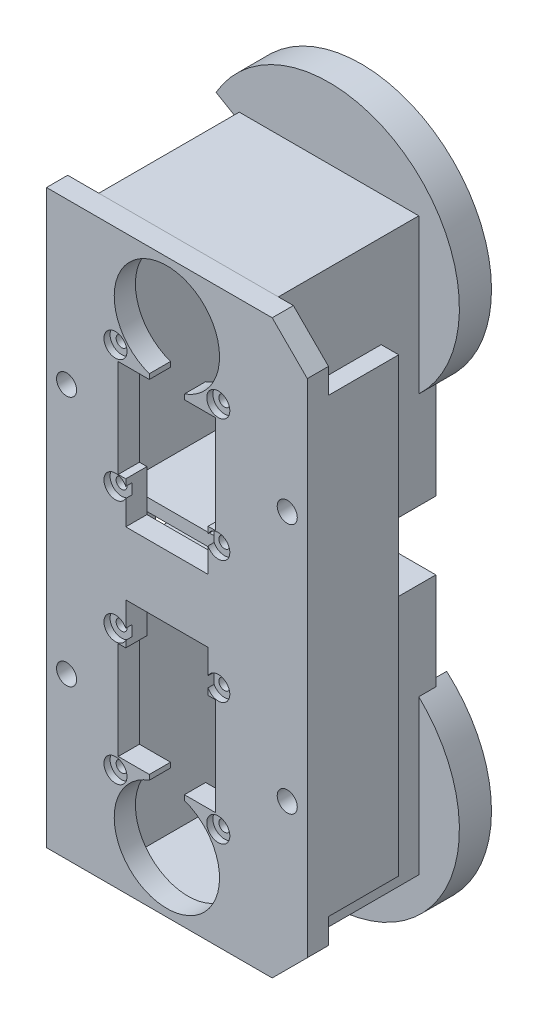
from build123d import *

# Parameters (mm, degrees)
BOSS_1_DEPTH    = 4.225
S_BOX2_W        = 3.5
S_BOX2_H        = 90
BOSS_2_DEPTH    = 14.5
S_BOX3_W        = 3.5
S_BOX3_H        = 90
BOSS_3_DEPTH    = 14.5
S_BOX4_W        = 35.8
S_BOX4_H        = 2.5
BOSS_4_DEPTH    = 35.725
S_BOX5_W        = 35.8
S_BOX5_H        = 1.2
BOSS_5_DEPTH    = 35.725
S_BOX6_W        = 5
S_BOX6_H        = 50.1
BOSS_6_DEPTH    = 35.725
S_BOX7_W        = 5
S_BOX7_H        = 50.1
BOSS_7_DEPTH    = 35.725
S_BOX8_W        = 35.8
S_BOX8_H        = 50.1
BOSS_8_DEPTH    = 4.225
S_CYL9_R        = 19
BOSS_9_DEPTH    = 2.6
BOSS_10_DEPTH   = 6.4
S_BOX11_W       = 35.8
S_BOX11_H       = 1.2
BOSS_11_DEPTH   = 35.725
S_BOX12_W       = 35.8
S_BOX12_H       = 2.5
BOSS_12_DEPTH   = 35.725
S_BOX13_W       = 5
S_BOX13_H       = 50.1
BOSS_13_DEPTH   = 35.725
S_BOX14_W       = 5
S_BOX14_H       = 50.1
BOSS_14_DEPTH   = 35.725
S_BOX15_W       = 35.8
S_BOX15_H       = 50.1
BOSS_15_DEPTH   = 4.225
S_CYL16_R       = 19
BOSS_16_DEPTH   = 2.6
BOSS_17_DEPTH   = 6.4
S_HOLE18_R      = 10.5
HOLE_18_DEPTH   = 4.425
S_CUT19_W       = 19.4
S_CUT19_H       = 19.5
POCKET_19_DEPTH = 4.375
S_CUT20_W       = 16.4
S_CUT20_H       = 8.3
POCKET_20_DEPTH = 4.375
S_CUT21_W       = 7
S_CUT21_H       = 11
POCKET_21_DEPTH = 4.375
S_HOLE22_R      = 1.1
HOLE_22_DEPTH   = 4.425
S_HOLE23_R      = 2.3
HOLE_23_DEPTH   = 1.325
S_HOLE24_R      = 1.1
HOLE_24_DEPTH   = 4.425
S_HOLE25_R      = 2.3
HOLE_25_DEPTH   = 1.325
S_HOLE26_R      = 1.1
HOLE_26_DEPTH   = 4.425
S_HOLE27_R      = 2.3
HOLE_27_DEPTH   = 1.325
S_HOLE28_R      = 1.1
HOLE_28_DEPTH   = 4.425
S_HOLE29_R      = 2.3
HOLE_29_DEPTH   = 1.325
S_CUT30_W       = 25.8
S_CUT30_H       = 46.4
POCKET_30_DEPTH = 6.65
S_HOLE31_R      = 11.5
HOLE_31_DEPTH   = 3.2
S_HOLE32_R      = 0.9
HOLE_32_DEPTH   = 5.7
S_HOLE33_R      = 0.9
HOLE_33_DEPTH   = 5.7
S_HOLE34_R      = 0.9
HOLE_34_DEPTH   = 5.7
S_HOLE35_R      = 0.9
HOLE_35_DEPTH   = 5.7
S_HOLE36_R      = 0.9
HOLE_36_DEPTH   = 5.7
S_HOLE37_R      = 10.5
HOLE_37_DEPTH   = 4.425
S_CUT38_W       = 19.4
S_CUT38_H       = 19.5
POCKET_38_DEPTH = 4.375
S_CUT39_W       = 16.4
S_CUT39_H       = 8.3
POCKET_39_DEPTH = 4.375
S_CUT40_W       = 7
S_CUT40_H       = 11
POCKET_40_DEPTH = 4.375
S_HOLE41_R      = 1.1
HOLE_41_DEPTH   = 4.425
S_HOLE42_R      = 2.3
HOLE_42_DEPTH   = 1.325
S_HOLE43_R      = 1.1
HOLE_43_DEPTH   = 4.425
S_HOLE44_R      = 2.3
HOLE_44_DEPTH   = 1.325
S_HOLE45_R      = 1.1
HOLE_45_DEPTH   = 4.425
S_HOLE46_R      = 2.3
HOLE_46_DEPTH   = 1.325
S_HOLE47_R      = 1.1
HOLE_47_DEPTH   = 4.425
S_HOLE48_R      = 2.3
HOLE_48_DEPTH   = 1.325
S_CUT49_W       = 25.8
S_CUT49_H       = 46.4
POCKET_49_DEPTH = 6.65
S_HOLE50_R      = 11.5
HOLE_50_DEPTH   = 3.2
S_HOLE51_R      = 0.9
HOLE_51_DEPTH   = 5.7
S_HOLE52_R      = 0.9
HOLE_52_DEPTH   = 5.7
S_HOLE53_R      = 0.9
HOLE_53_DEPTH   = 5.7
S_HOLE54_R      = 0.9
HOLE_54_DEPTH   = 5.7
S_HOLE55_R      = 0.9
HOLE_55_DEPTH   = 5.7
S_HOLE56_R      = 2
HOLE_56_DEPTH   = 4.425
S_HOLE57_R      = 1.7
HOLE_57_DEPTH   = 4.1
S_HOLE58_R      = 2
HOLE_58_DEPTH   = 4.425
S_HOLE59_R      = 1.7
HOLE_59_DEPTH   = 4.1
S_HOLE60_R      = 2
HOLE_60_DEPTH   = 4.425
S_HOLE61_R      = 1.7
HOLE_61_DEPTH   = 4.1
S_HOLE62_R      = 2
HOLE_62_DEPTH   = 4.425
S_HOLE63_R      = 1.7
HOLE_63_DEPTH   = 4.1


with BuildPart() as part:
    # S_prism1 → Boss_1 (new body)
    with BuildSketch(Plane.XY.offset(64.7)):
        Polygon((28, -50), (28, 50), (21, 57), (-24, 57), (-24, -57), (21, -57), align=None)
    extrude(amount=BOSS_1_DEPTH)

    # S_box2 → Boss_2 (add)
    with BuildSketch(Plane.XY.offset(50.7)):
        with Locations((26.25, 0)):
            Rectangle(S_BOX2_W, S_BOX2_H)
    extrude(amount=BOSS_2_DEPTH)

    # S_box3 → Boss_3 (add)
    with BuildSketch(Plane.XY.offset(50.7)):
        with Locations((-22.25, 0)):
            Rectangle(S_BOX3_W, S_BOX3_H)
    extrude(amount=BOSS_3_DEPTH)

    # S_box4 → Boss_4 (add)
    with BuildSketch(Plane.XY.offset(33.2)):
        with Locations((0, 8.05)):
            Rectangle(S_BOX4_W, S_BOX4_H)
    extrude(amount=BOSS_4_DEPTH)

    # S_box5 → Boss_5 (add)
    with BuildSketch(Plane.XY.offset(33.2)):
        with Locations((0, 56.3)):
            Rectangle(S_BOX5_W, S_BOX5_H)
    extrude(amount=BOSS_5_DEPTH)

    # S_box6 → Boss_6 (add)
    with BuildSketch(Plane.XY.offset(33.2)):
        with Locations((-15.4, 31.85)):
            Rectangle(S_BOX6_W, S_BOX6_H)
    extrude(amount=BOSS_6_DEPTH)

    # S_box7 → Boss_7 (add)
    with BuildSketch(Plane.XY.offset(33.2)):
        with Locations((15.4, 31.85)):
            Rectangle(S_BOX7_W, S_BOX7_H)
    extrude(amount=BOSS_7_DEPTH)

    # S_box8 → Boss_8 (add)
    with BuildSketch(Plane.XY.offset(64.7)):
        with Locations((0, 31.85)):
            Rectangle(S_BOX8_W, S_BOX8_H)
    extrude(amount=BOSS_8_DEPTH)



with BuildPart() as body_2:
    # S_cyl9 → Boss_9 (new body)
    with BuildSketch(Plane.XY.offset(30.1)):
        with Locations((0, 45)):
            Circle(S_CYL9_R)
    extrude(amount=BOSS_9_DEPTH)


with BuildPart() as part_1:
    add(part.part)

    add(body_2.part)  # Boss_10 merges body 2
    # S_prism10 → Boss_10 (add)
    with BuildSketch(Plane.XY.offset(30.2)):
        with BuildLine():
            Line((-22.516660498, 58), (-9.526279442, 50.5))
            ThreePointArc((-9.526279442, 50.5), (6.996860423, 53.487870417), (7.216649319, 36.698194618))
            Line((7.216649319, 36.698194618), (17.057534754, 25.377550914))
            ThreePointArc((17.057534754, 25.377550914), (16.538033727, 65.062239168), (-22.516660498, 58))
        make_face()
    extrude(amount=BOSS_10_DEPTH)

    # S_box11 → Boss_11 (add)
    with BuildSketch(Plane.XY.offset(33.2)):
        with Locations((0, -56.3)):
            Rectangle(S_BOX11_W, S_BOX11_H)
    extrude(amount=BOSS_11_DEPTH)

    # S_box12 → Boss_12 (add)
    with BuildSketch(Plane.XY.offset(33.2)):
        with Locations((0, -8.05)):
            Rectangle(S_BOX12_W, S_BOX12_H)
    extrude(amount=BOSS_12_DEPTH)

    # S_box13 → Boss_13 (add)
    with BuildSketch(Plane.XY.offset(33.2)):
        with Locations((-15.4, -31.85)):
            Rectangle(S_BOX13_W, S_BOX13_H)
    extrude(amount=BOSS_13_DEPTH)

    # S_box14 → Boss_14 (add)
    with BuildSketch(Plane.XY.offset(33.2)):
        with Locations((15.4, -31.85)):
            Rectangle(S_BOX14_W, S_BOX14_H)
    extrude(amount=BOSS_14_DEPTH)

    # S_box15 → Boss_15 (add)
    with BuildSketch(Plane.XY.offset(64.7)):
        with Locations((0, -31.85)):
            Rectangle(S_BOX15_W, S_BOX15_H)
    extrude(amount=BOSS_15_DEPTH)



with BuildPart() as body_2_2:
    # S_cyl16 → Boss_16 (new body)
    with BuildSketch(Plane.XY.offset(30.1)):
        with Locations((0, -45)):
            Circle(S_CYL16_R)
    extrude(amount=BOSS_16_DEPTH)


with BuildPart() as part_2:
    add(part_1.part)

    add(body_2_2.part)  # Boss_17 merges body 2 2
    # S_prism17 → Boss_17 (add)
    with BuildSketch(Plane.XY.offset(30.2)):
        with BuildLine():
            Line((17.057534754, -25.377550914), (7.216649319, -36.698194618))
            ThreePointArc((7.216649319, -36.698194618), (6.996860423, -53.487870417), (-9.526279442, -50.5))
            Line((-9.526279442, -50.5), (-22.516660498, -58))
            ThreePointArc((-22.516660498, -58), (16.538033727, -65.062239168), (17.057534754, -25.377550914))
        make_face()
    extrude(amount=BOSS_17_DEPTH)

    # S_hole18 → Hole_18 (cut)
    with BuildSketch(Plane.XY.offset(64.6)):
        with Locations((0, 45)):
            Circle(S_HOLE18_R)
    extrude(amount=HOLE_18_DEPTH, mode=Mode.SUBTRACT)

    # S_cut19 → Pocket_19 (cut)
    with BuildSketch(Plane.XY.offset(64.65)):
        with Locations((0, 24.35)):
            Rectangle(S_CUT19_W, S_CUT19_H)
    extrude(amount=POCKET_19_DEPTH, mode=Mode.SUBTRACT)

    # S_cut20 → Pocket_20 (cut)
    with BuildSketch(Plane.XY.offset(64.65)):
        with Locations((0, 10.45)):
            Rectangle(S_CUT20_W, S_CUT20_H)
    extrude(amount=POCKET_20_DEPTH, mode=Mode.SUBTRACT)

    # S_cut21 → Pocket_21 (cut)
    with BuildSketch(Plane.XY.offset(64.65)):
        with Locations((0, 39.5)):
            Rectangle(S_CUT21_W, S_CUT21_H)
    extrude(amount=POCKET_21_DEPTH, mode=Mode.SUBTRACT)

    # S_hole22 → Hole_22 (cut)
    with BuildSketch(Plane.XY.offset(64.6)):
        with Locations((-10.25, 36.7)):
            Circle(S_HOLE22_R)
    extrude(amount=HOLE_22_DEPTH, mode=Mode.SUBTRACT)

    # S_hole23 → Hole_23 (cut)
    with BuildSketch(Plane.XY.offset(67.7)):
        with Locations((-10.25, 36.7)):
            Circle(S_HOLE23_R)
    extrude(amount=HOLE_23_DEPTH, mode=Mode.SUBTRACT)

    # S_hole24 → Hole_24 (cut)
    with BuildSketch(Plane.XY.offset(64.6)):
        with Locations((10.25, 36.7)):
            Circle(S_HOLE24_R)
    extrude(amount=HOLE_24_DEPTH, mode=Mode.SUBTRACT)

    # S_hole25 → Hole_25 (cut)
    with BuildSketch(Plane.XY.offset(67.7)):
        with Locations((10.25, 36.7)):
            Circle(S_HOLE25_R)
    extrude(amount=HOLE_25_DEPTH, mode=Mode.SUBTRACT)

    # S_hole26 → Hole_26 (cut)
    with BuildSketch(Plane.XY.offset(64.6)):
        with Locations((-10.25, 12.25)):
            Circle(S_HOLE26_R)
    extrude(amount=HOLE_26_DEPTH, mode=Mode.SUBTRACT)

    # S_hole27 → Hole_27 (cut)
    with BuildSketch(Plane.XY.offset(67.7)):
        with Locations((-10.25, 12.25)):
            Circle(S_HOLE27_R)
    extrude(amount=HOLE_27_DEPTH, mode=Mode.SUBTRACT)

    # S_hole28 → Hole_28 (cut)
    with BuildSketch(Plane.XY.offset(64.6)):
        with Locations((10.25, 12.25)):
            Circle(S_HOLE28_R)
    extrude(amount=HOLE_28_DEPTH, mode=Mode.SUBTRACT)

    # S_hole29 → Hole_29 (cut)
    with BuildSketch(Plane.XY.offset(67.7)):
        with Locations((10.25, 12.25)):
            Circle(S_HOLE29_R)
    extrude(amount=HOLE_29_DEPTH, mode=Mode.SUBTRACT)

    # S_cut30 → Pocket_30 (cut)
    with BuildSketch(Plane.XY.offset(30.05)):
        with Locations((0, 32.5)):
            Rectangle(S_CUT30_W, S_CUT30_H)
    extrude(amount=POCKET_30_DEPTH, mode=Mode.SUBTRACT)

    # S_hole31 → Hole_31 (cut)
    with BuildSketch(Plane.XY.offset(30.1)):
        with Locations((0, 45)):
            Circle(S_HOLE31_R)
    extrude(amount=HOLE_31_DEPTH, mode=Mode.SUBTRACT)

    # S_hole32 → Hole_32 (cut)
    with BuildSketch(Plane.XY.offset(30.1)):
        with Locations((18.021344974, 32.3813184)):
            Circle(S_HOLE32_R)
    extrude(amount=HOLE_32_DEPTH, mode=Mode.SUBTRACT)

    # S_hole33 → Hole_33 (cut)
    with BuildSketch(Plane.XY.offset(30.1)):
        with Locations((21.916283358, 46.91742634)):
            Circle(S_HOLE33_R)
    extrude(amount=HOLE_33_DEPTH, mode=Mode.SUBTRACT)

    # S_hole34 → Hole_34 (cut)
    with BuildSketch(Plane.XY.offset(30.1)):
        with Locations((15.556349186, 60.556349186)):
            Circle(S_HOLE34_R)
    extrude(amount=HOLE_34_DEPTH, mode=Mode.SUBTRACT)

    # S_hole35 → Hole_35 (cut)
    with BuildSketch(Plane.XY.offset(30.1)):
        with Locations((1.91742634, 66.916283358)):
            Circle(S_HOLE35_R)
    extrude(amount=HOLE_35_DEPTH, mode=Mode.SUBTRACT)

    # S_hole36 → Hole_36 (cut)
    with BuildSketch(Plane.XY.offset(30.1)):
        with Locations((-9.297601758, 64.938771315)):
            Circle(S_HOLE36_R)
    extrude(amount=HOLE_36_DEPTH, mode=Mode.SUBTRACT)

    # S_hole37 → Hole_37 (cut)
    with BuildSketch(Plane.XY.offset(64.6)):
        with Locations((0, -45)):
            Circle(S_HOLE37_R)
    extrude(amount=HOLE_37_DEPTH, mode=Mode.SUBTRACT)

    # S_cut38 → Pocket_38 (cut)
    with BuildSketch(Plane.XY.offset(64.65)):
        with Locations((0, -24.35)):
            Rectangle(S_CUT38_W, S_CUT38_H)
    extrude(amount=POCKET_38_DEPTH, mode=Mode.SUBTRACT)

    # S_cut39 → Pocket_39 (cut)
    with BuildSketch(Plane.XY.offset(64.65)):
        with Locations((0, -10.45)):
            Rectangle(S_CUT39_W, S_CUT39_H)
    extrude(amount=POCKET_39_DEPTH, mode=Mode.SUBTRACT)

    # S_cut40 → Pocket_40 (cut)
    with BuildSketch(Plane.XY.offset(64.65)):
        with Locations((0, -39.5)):
            Rectangle(S_CUT40_W, S_CUT40_H)
    extrude(amount=POCKET_40_DEPTH, mode=Mode.SUBTRACT)

    # S_hole41 → Hole_41 (cut)
    with BuildSketch(Plane.XY.offset(64.6)):
        with Locations((-10.25, -36.7)):
            Circle(S_HOLE41_R)
    extrude(amount=HOLE_41_DEPTH, mode=Mode.SUBTRACT)

    # S_hole42 → Hole_42 (cut)
    with BuildSketch(Plane.XY.offset(67.7)):
        with Locations((-10.25, -36.7)):
            Circle(S_HOLE42_R)
    extrude(amount=HOLE_42_DEPTH, mode=Mode.SUBTRACT)

    # S_hole43 → Hole_43 (cut)
    with BuildSketch(Plane.XY.offset(64.6)):
        with Locations((10.25, -36.7)):
            Circle(S_HOLE43_R)
    extrude(amount=HOLE_43_DEPTH, mode=Mode.SUBTRACT)

    # S_hole44 → Hole_44 (cut)
    with BuildSketch(Plane.XY.offset(67.7)):
        with Locations((10.25, -36.7)):
            Circle(S_HOLE44_R)
    extrude(amount=HOLE_44_DEPTH, mode=Mode.SUBTRACT)

    # S_hole45 → Hole_45 (cut)
    with BuildSketch(Plane.XY.offset(64.6)):
        with Locations((-10.25, -12.25)):
            Circle(S_HOLE45_R)
    extrude(amount=HOLE_45_DEPTH, mode=Mode.SUBTRACT)

    # S_hole46 → Hole_46 (cut)
    with BuildSketch(Plane.XY.offset(67.7)):
        with Locations((-10.25, -12.25)):
            Circle(S_HOLE46_R)
    extrude(amount=HOLE_46_DEPTH, mode=Mode.SUBTRACT)

    # S_hole47 → Hole_47 (cut)
    with BuildSketch(Plane.XY.offset(64.6)):
        with Locations((10.25, -12.25)):
            Circle(S_HOLE47_R)
    extrude(amount=HOLE_47_DEPTH, mode=Mode.SUBTRACT)

    # S_hole48 → Hole_48 (cut)
    with BuildSketch(Plane.XY.offset(67.7)):
        with Locations((10.25, -12.25)):
            Circle(S_HOLE48_R)
    extrude(amount=HOLE_48_DEPTH, mode=Mode.SUBTRACT)

    # S_cut49 → Pocket_49 (cut)
    with BuildSketch(Plane.XY.offset(30.05)):
        with Locations((0, -32.5)):
            Rectangle(S_CUT49_W, S_CUT49_H)
    extrude(amount=POCKET_49_DEPTH, mode=Mode.SUBTRACT)

    # S_hole50 → Hole_50 (cut)
    with BuildSketch(Plane.XY.offset(30.1)):
        with Locations((0, -45)):
            Circle(S_HOLE50_R)
    extrude(amount=HOLE_50_DEPTH, mode=Mode.SUBTRACT)

    # S_hole51 → Hole_51 (cut)
    with BuildSketch(Plane.XY.offset(30.1)):
        with Locations((18.021344974, -32.3813184)):
            Circle(S_HOLE51_R)
    extrude(amount=HOLE_51_DEPTH, mode=Mode.SUBTRACT)

    # S_hole52 → Hole_52 (cut)
    with BuildSketch(Plane.XY.offset(30.1)):
        with Locations((21.916283358, -46.91742634)):
            Circle(S_HOLE52_R)
    extrude(amount=HOLE_52_DEPTH, mode=Mode.SUBTRACT)

    # S_hole53 → Hole_53 (cut)
    with BuildSketch(Plane.XY.offset(30.1)):
        with Locations((15.556349186, -60.556349186)):
            Circle(S_HOLE53_R)
    extrude(amount=HOLE_53_DEPTH, mode=Mode.SUBTRACT)

    # S_hole54 → Hole_54 (cut)
    with BuildSketch(Plane.XY.offset(30.1)):
        with Locations((1.91742634, -66.916283358)):
            Circle(S_HOLE54_R)
    extrude(amount=HOLE_54_DEPTH, mode=Mode.SUBTRACT)

    # S_hole55 → Hole_55 (cut)
    with BuildSketch(Plane.XY.offset(30.1)):
        with Locations((-9.297601758, -64.938771315)):
            Circle(S_HOLE55_R)
    extrude(amount=HOLE_55_DEPTH, mode=Mode.SUBTRACT)

    # S_hole56 → Hole_56 (cut)
    with BuildSketch(Plane.XY.offset(64.6)):
        with Locations((-20, -25)):
            Circle(S_HOLE56_R)
    extrude(amount=HOLE_56_DEPTH, mode=Mode.SUBTRACT)

    # S_hole57 → Hole_57 (cut)
    with BuildSketch(Plane.XY.offset(60.7)):
        with Locations((-20, -25)):
            Circle(S_HOLE57_R)
    extrude(amount=HOLE_57_DEPTH, mode=Mode.SUBTRACT)

    # S_hole58 → Hole_58 (cut)
    with BuildSketch(Plane.XY.offset(64.6)):
        with Locations((-20, 25)):
            Circle(S_HOLE58_R)
    extrude(amount=HOLE_58_DEPTH, mode=Mode.SUBTRACT)

    # S_hole59 → Hole_59 (cut)
    with BuildSketch(Plane.XY.offset(60.7)):
        with Locations((-20, 25)):
            Circle(S_HOLE59_R)
    extrude(amount=HOLE_59_DEPTH, mode=Mode.SUBTRACT)

    # S_hole60 → Hole_60 (cut)
    with BuildSketch(Plane.XY.offset(64.6)):
        with Locations((24, -25)):
            Circle(S_HOLE60_R)
    extrude(amount=HOLE_60_DEPTH, mode=Mode.SUBTRACT)

    # S_hole61 → Hole_61 (cut)
    with BuildSketch(Plane.XY.offset(60.7)):
        with Locations((24, -25)):
            Circle(S_HOLE61_R)
    extrude(amount=HOLE_61_DEPTH, mode=Mode.SUBTRACT)

    # S_hole62 → Hole_62 (cut)
    with BuildSketch(Plane.XY.offset(64.6)):
        with Locations((24, 25)):
            Circle(S_HOLE62_R)
    extrude(amount=HOLE_62_DEPTH, mode=Mode.SUBTRACT)

    # S_hole63 → Hole_63 (cut)
    with BuildSketch(Plane.XY.offset(60.7)):
        with Locations((24, 25)):
            Circle(S_HOLE63_R)
    extrude(amount=HOLE_63_DEPTH, mode=Mode.SUBTRACT)


solid = part_2.part
